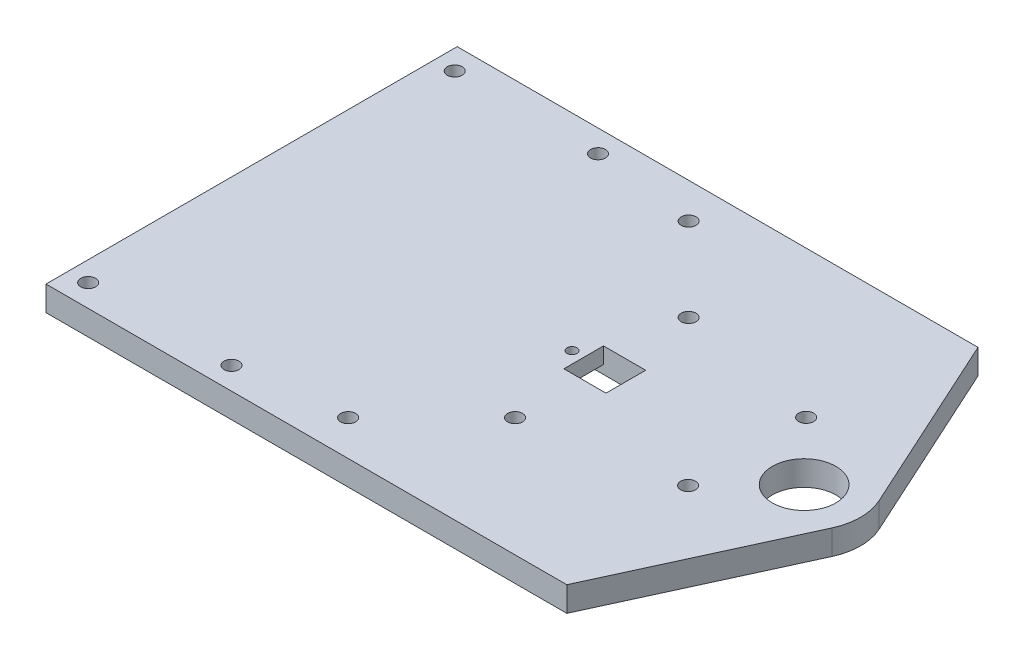
from build123d import *

# Parameters (mm, degrees)
SKETCH1_R           = 6.4
BOSS_EXTRUDE1_DEPTH = 5
SKETCH7_R           = 1.5
CUT_EXTRUDE4_DEPTH  = 10
BOSS_EXTRUDE2_DEPTH = 10
BOSS_EXTRUDE3_DEPTH = 4
FILLET1_R           = 2
FILLET2_R           = 2
SKETCH12_R          = 1.5
CUT_EXTRUDE5_DEPTH  = 13
SKETCH13_W          = 8.5
SKETCH13_H          = 8
CUT_EXTRUDE6_DEPTH  = 13
SKETCH13_3_R        = 3
SKETCH13_3_W        = 13
SKETCH13_3_H        = 8
CUT_EXTRUDE7_DEPTH  = 1.75
SKETCH15_R          = 1
CUT_EXTRUDE9_DEPTH  = 10


with BuildPart() as part:
    # Sketch1 → Boss-Extrude1 (new body)
    with BuildSketch(Plane(origin=(0, 0, 0), x_dir=(1, 0, 0), z_dir=(0, 1, 0))):
        with BuildLine():
            ThreePointArc((54.302519507, -4.751051874), (55.339723673, -0.00587799), (54.307413406, 4.740362963))
            Line((54.307413406, 4.740362963), (37.5, 41.5))
            Line((37.5, 41.5), (-67.5, 41.5))
            Line((-67.5, 41.5), (-67.5, -41.4))
            Line((-67.5, -41.4), (37.5, -41.4))
            Line((37.5, -41.4), (54.302519507, -4.751051874))
        make_face()
        with Locations(Location((43.939725188, 0, 0), (0, 0, 270))):
            Circle(SKETCH1_R, mode=Mode.SUBTRACT)
    extrude(amount=BOSS_EXTRUDE1_DEPTH)

    # Sketch7 → Cut-Extrude4 (cut)
    with BuildSketch(Plane.XZ):
        with Locations(Location((-34.6, 36.9, 0), (0, 0, 270))):
            Circle(SKETCH7_R)
        with Locations(Location((-63.5, 36.9, 0), (0, 0, 270))):
            Circle(SKETCH7_R)
        with Locations(Location((-63.5, -37, 0), (0, 0, 270))):
            Circle(SKETCH7_R)
        with Locations(Location((-34.6, -37, 0), (0, 0, 270))):
            Circle(SKETCH7_R)
    extrude(amount=-CUT_EXTRUDE4_DEPTH, mode=Mode.SUBTRACT)

    # Sketch9 → Boss-Extrude2 (add)
    with BuildSketch(Plane.XZ):
        Polygon((-35.7, 26.505), (-62.5, 26.505), (-62.5, 23.505), (-38.7, 23.505), (-38.7, -20.995), (-62.5, -20.995), (-62.5, -23.995), (-35.7, -23.995), align=None)
    extrude(amount=BOSS_EXTRUDE2_DEPTH)

    # Sketch9<3> → Boss-Extrude3 (add)
    with BuildSketch(Plane.XZ):
        Polygon((-62.5, 26.505), (-64.5, 26.505), (-64.5, 21.505), (-62.5, 23.505), align=None)
        Polygon((-64.5, -18.995), (-64.5, -23.995), (-62.5, -23.995), (-62.5, -20.995), align=None)
    extrude(amount=BOSS_EXTRUDE3_DEPTH)

    # Fillet1
    fillet1_edges = [part.edges().sort_by_distance(p)[0] for p in [
        (-62.5, -4, 25.005),
        (-62.5, -4, -22.495),
    ]]
    fillet(fillet1_edges, radius=FILLET1_R - 0.0001)  # a hair under: the kernel refuses the full size

    # Fillet2
    fillet2_edges = [part.edges().sort_by_distance(p)[0] for p in [
        (-35.7, -5, 26.505),
        (-35.7, -5, -23.995),
    ]]
    fillet(fillet2_edges, radius=FILLET2_R)

    # Sketch12 → Cut-Extrude5 (cut)
    with BuildSketch(Plane.XZ):
        with Locations(Location((32.4, 11.85, 0), (0, 0, 270))):
            Circle(SKETCH12_R)
        with Locations(Location((32.4, -11.95, 0), (0, 0, 270))):
            Circle(SKETCH12_R)
        with Locations(Location((3.115937957, -17.546796564, 0), (0, 0, 270))):
            Circle(SKETCH12_R)
        with Locations(Location((-13.713203436, -34.375937957, 0), (0, 0, 270))):
            Circle(SKETCH12_R)
        with Locations(Location((3.115937957, 17.446796564, 0), (0, 0, 270))):
            Circle(SKETCH12_R)
        with Locations(Location((-13.713203436, 34.275937957, 0), (0, 0, 270))):
            Circle(SKETCH12_R)
    extrude(amount=-CUT_EXTRUDE5_DEPTH, mode=Mode.SUBTRACT)

    # Sketch13 → Cut-Extrude6 (cut)
    with BuildSketch(Plane.XZ):
        with Locations((3.75, 0)):
            Rectangle(SKETCH13_W, SKETCH13_H)
    extrude(amount=-CUT_EXTRUDE6_DEPTH, mode=Mode.SUBTRACT)

    # Sketch13<3> → Cut-Extrude7 (cut)
    with BuildSketch(Plane.XZ):
        with Locations((-3.85, 0)):
            Circle(SKETCH13_3_R)
        with Locations((1.5, 0)):
            Rectangle(SKETCH13_3_W, SKETCH13_3_H)
    extrude(amount=-CUT_EXTRUDE7_DEPTH, mode=Mode.SUBTRACT)

    # Sketch15 → Cut-Extrude9 (cut)
    with BuildSketch(Plane.XZ.offset(-1.75)):
        with Locations(Location((-2.85, 0, 0), (0, 0, 270))):
            Circle(SKETCH15_R)
    extrude(amount=-CUT_EXTRUDE9_DEPTH, mode=Mode.SUBTRACT)


solid = part.part
